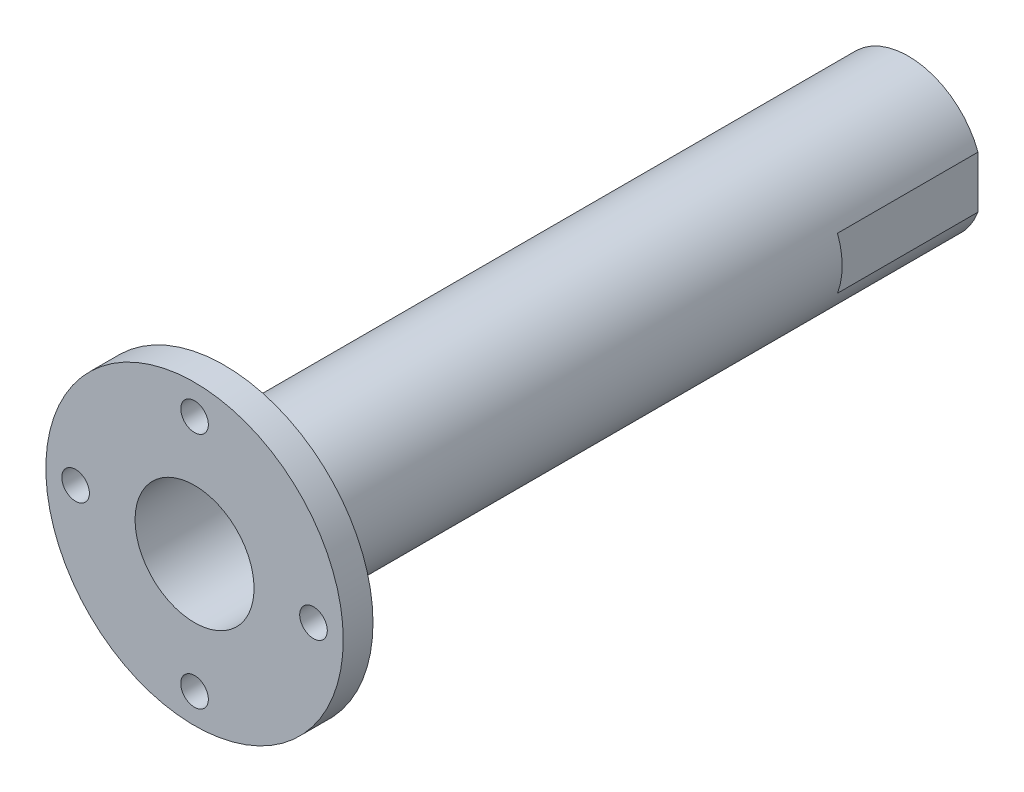
from build123d import *

# Parameters (mm, degrees)
SKETCH1_R                 = 7.9375
SKETCH1_R_2               = 6.35
BOSS_EXTRUDE1_DEPTH       = 76.2
BOSS_EXTRUDE2_START       = -3.175
SKETCH2_R                 = 15.875
SKETCH2_R_2               = 6.35
BOSS_EXTRUDE2_DEPTH       = 3.175
F_4_CLEARANCE_HOLE1_D     = 2.9464
F_4_CLEARANCE_HOLE1_DEPTH = 4
F_4_CLEARANCE_HOLE1_TIP   = 0.885187864
CUT_EXTRUDE1_DEPTH        = 80.43847462
CUT_EXTRUDE1_DEPTH_BACK   = 80.43847462
SKETCH6_W                 = 4.137147463
SKETCH6_H                 = 15


with BuildPart() as part:
    # Sketch1 → Boss-Extrude1 (new body)
    with BuildSketch(Plane.XY):
        Circle(SKETCH1_R)
        Circle(SKETCH1_R_2, mode=Mode.SUBTRACT)
    extrude(amount=BOSS_EXTRUDE1_DEPTH)

    # Sketch2 → Boss-Extrude2 (add)
    with BuildSketch(Plane.XY.offset(76.2).offset(BOSS_EXTRUDE2_START)):
        Circle(SKETCH2_R)
        Circle(SKETCH2_R_2, mode=Mode.SUBTRACT)
    extrude(amount=BOSS_EXTRUDE2_DEPTH)

    # #4 Clearance Hole1
    with Locations(Plane.XY.offset(76.2)):
        with Locations((0, 12.7), (0, -12.7), (12.7, 0), (-12.7, 0)):
            Hole(F_4_CLEARANCE_HOLE1_D / 2, depth=F_4_CLEARANCE_HOLE1_DEPTH)
            with Locations((0, 0, -(F_4_CLEARANCE_HOLE1_DEPTH + F_4_CLEARANCE_HOLE1_TIP / 2))):  # 118° drill point
                Cone(0, F_4_CLEARANCE_HOLE1_D / 2, F_4_CLEARANCE_HOLE1_TIP, mode=Mode.SUBTRACT)

    # Sketch6 → Cut-Extrude1 (cut, two sides: drawn at the far end of the back side and taken through both)
    with BuildSketch(Plane(origin=(0, 0, 0), x_dir=(1, 0, 0), z_dir=(0, 1, 0)).offset(-CUT_EXTRUDE1_DEPTH_BACK)):
        with Locations((9.506073732, -7.5)):
            Rectangle(SKETCH6_W, SKETCH6_H)
    extrude(amount=CUT_EXTRUDE1_DEPTH + CUT_EXTRUDE1_DEPTH_BACK, mode=Mode.SUBTRACT)


solid = part.part
